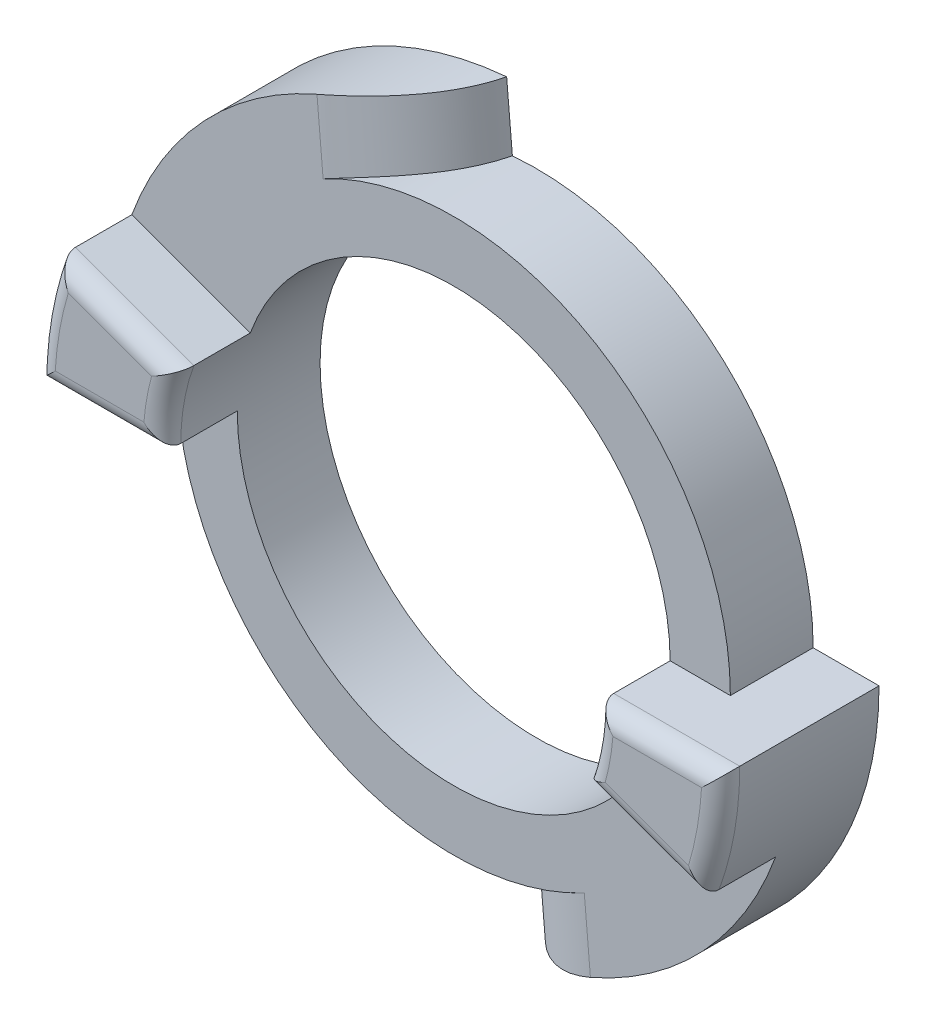
from build123d import *

# Parameters (mm, degrees)
BOSS_EXTRUDE1_DEPTH = 2.2
BOSS_EXTRUDE2_DEPTH = 2
FILLET1_R           = 0.5
FILLET2_R           = 3


with BuildPart() as part:
    # Sketch3 → Boss-Extrude1 (new body)
    with BuildSketch(Plane.XY):
        with BuildLine():
            ThreePointArc((-7.35, 0), (-7.238336985, 1.276314106), (-6.906740763, 2.513848053))
            Line((-6.906740763, 2.513848053), (-8.551202849, 3.112383304))
            ThreePointArc((-8.551202849, 3.112383304), (-8.961750552, 1.580198417), (-9.1, 0))
            Line((-9.1, 0), (-7.35, 0))
        make_face()
        with BuildLine():
            Line((-8.551202849, 3.112383304), (-6.906740763, 2.513848053))
            ThreePointArc((-6.906740763, 2.513848053), (-4.474396503, 5.831147051), (-0.640594709, 7.322031031))
            Line((-0.640594709, 7.322031031), (-0.793117259, 9.065371753))
            ThreePointArc((-0.793117259, 9.065371753), (-5.539729004, 7.219515397), (-8.551202849, 3.112383304))
        make_face()
        with BuildLine():
            Line((3.550704156, 6.15), (7.101408311, 0))
            Line((7.101408311, 0), (7.35, 0))
            ThreePointArc((7.35, 0), (4.965588026, 5.418988426), (-0.640594709, 7.322031031))
            Line((-0.640594709, 7.322031031), (-0.538055281, 6.15))
            Line((-0.538055281, 6.15), (3.550704156, 6.15))
        make_face()
        with BuildLine():
            ThreePointArc((-0.501145521, 5.728119514), (3.884643694, 4.239344687), (5.75, 0))
            Line((5.75, 0), (7.101408311, 0))
            Line((7.101408311, 0), (3.550704156, 6.15))
            Line((3.550704156, 6.15), (-0.538055281, 6.15))
            Line((-0.538055281, 6.15), (-0.501145521, 5.728119514))
        make_face()
        with BuildLine():
            Line((-5.868261699, 2.135872585), (-5.40323257, 1.966615824))
            ThreePointArc((-5.40323257, 1.966615824), (-3.500378217, 4.561781707), (-0.501145521, 5.728119514))
            Line((-0.501145521, 5.728119514), (-0.538055281, 6.15))
            Line((-0.538055281, 6.15), (-3.550704156, 6.15))
            Line((-3.550704156, 6.15), (-5.868261699, 2.135872585))
        make_face()
        with BuildLine():
            Line((-6.906740763, 2.513848053), (-5.868261699, 2.135872585))
            Line((-5.868261699, 2.135872585), (-3.550704156, 6.15))
            Line((-3.550704156, 6.15), (-0.538055281, 6.15))
            Line((-0.538055281, 6.15), (-0.640594709, 7.322031031))
            ThreePointArc((-0.640594709, 7.322031031), (-4.474396503, 5.831147051), (-6.906740763, 2.513848053))
        make_face()
        with BuildLine():
            Line((-7.101408311, 0), (-5.868261699, 2.135872585))
            Line((-5.868261699, 2.135872585), (-6.906740763, 2.513848053))
            ThreePointArc((-6.906740763, 2.513848053), (-7.238336985, 1.276314106), (-7.35, 0))
            Line((-7.35, 0), (-7.101408311, 0))
        make_face()
        with BuildLine():
            ThreePointArc((-5.75, 0), (-5.66264458, 0.998477022), (-5.40323257, 1.966615824))
            Line((-5.40323257, 1.966615824), (-5.868261699, 2.135872585))
            Line((-5.868261699, 2.135872585), (-7.101408311, 0))
            Line((-7.101408311, 0), (-5.75, 0))
        make_face()
        with BuildLine():
            Line((7.101408311, 0), (5.868261699, -2.135872585))
            Line((5.868261699, -2.135872585), (6.906740763, -2.513848053))
            ThreePointArc((6.906740763, -2.513848053), (7.238336985, -1.276314106), (7.35, 0))
            Line((7.35, 0), (7.101408311, 0))
        make_face()
        with BuildLine():
            ThreePointArc((5.75, 0), (5.66264458, -0.998477022), (5.40323257, -1.966615824))
            Line((5.40323257, -1.966615824), (5.868261699, -2.135872585))
            Line((5.868261699, -2.135872585), (7.101408311, 0))
            Line((7.101408311, 0), (5.75, 0))
        make_face()
        with BuildLine():
            Line((6.906740763, -2.513848053), (5.868261699, -2.135872585))
            Line((5.868261699, -2.135872585), (3.550704156, -6.15))
            Line((3.550704156, -6.15), (0.538055281, -6.15))
            Line((0.538055281, -6.15), (0.640594709, -7.322031031))
            ThreePointArc((0.640594709, -7.322031031), (4.474396503, -5.831147051), (6.906740763, -2.513848053))
        make_face()
        with BuildLine():
            Line((5.868261699, -2.135872585), (5.40323257, -1.966615824))
            ThreePointArc((5.40323257, -1.966615824), (3.500378217, -4.561781707), (0.501145521, -5.728119514))
            Line((0.501145521, -5.728119514), (0.538055281, -6.15))
            Line((0.538055281, -6.15), (3.550704156, -6.15))
            Line((3.550704156, -6.15), (5.868261699, -2.135872585))
        make_face()
        with BuildLine():
            Line((-3.550704156, -6.15), (-7.101408311, 0))
            Line((-7.101408311, 0), (-7.35, 0))
            ThreePointArc((-7.35, 0), (-4.965588026, -5.418988426), (0.640594709, -7.322031031))
            Line((0.640594709, -7.322031031), (0.538055281, -6.15))
            Line((0.538055281, -6.15), (-3.550704156, -6.15))
        make_face()
        with BuildLine():
            ThreePointArc((0.501145521, -5.728119514), (-3.884643694, -4.239344687), (-5.75, 0))
            Line((-5.75, 0), (-7.101408311, 0))
            Line((-7.101408311, 0), (-3.550704156, -6.15))
            Line((-3.550704156, -6.15), (0.538055281, -6.15))
            Line((0.538055281, -6.15), (0.501145521, -5.728119514))
        make_face()
        with BuildLine():
            Line((8.551202849, -3.112383304), (6.906740763, -2.513848053))
            ThreePointArc((6.906740763, -2.513848053), (4.474396503, -5.831147051), (0.640594709, -7.322031031))
            Line((0.640594709, -7.322031031), (0.793117259, -9.065371753))
            ThreePointArc((0.793117259, -9.065371753), (5.539729004, -7.219515397), (8.551202849, -3.112383304))
        make_face()
        with BuildLine():
            ThreePointArc((7.35, 0), (7.238336985, -1.276314106), (6.906740763, -2.513848053))
            Line((6.906740763, -2.513848053), (8.551202849, -3.112383304))
            ThreePointArc((8.551202849, -3.112383304), (8.961750552, -1.580198417), (9.1, 0))
            Line((9.1, 0), (7.35, 0))
        make_face()
    extrude(amount=BOSS_EXTRUDE1_DEPTH)

    # Sketch4 → Boss-Extrude2 (add)
    with BuildSketch(Plane.XY.offset(2.2)):
        with BuildLine():
            Line((-7.35, 0), (-5.75, 0))
            ThreePointArc((-5.75, 0), (-5.66264458, 0.998477022), (-5.40323257, 1.966615824))
            Line((-5.40323257, 1.966615824), (-8.551202849, 3.112383304))
            ThreePointArc((-8.551202849, 3.112383304), (-8.961750552, 1.580198417), (-9.1, 0))
            Line((-9.1, 0), (-7.35, 0))
        make_face()
        with BuildLine():
            Line((7.35, 0), (5.75, 0))
            ThreePointArc((5.75, 0), (5.66264458, -0.998477022), (5.40323257, -1.966615824))
            Line((5.40323257, -1.966615824), (8.551202849, -3.112383304))
            ThreePointArc((8.551202849, -3.112383304), (8.961750552, -1.580198417), (9.1, 0))
            Line((9.1, 0), (7.35, 0))
        make_face()
    extrude(amount=BOSS_EXTRUDE2_DEPTH)

    # Fillet1
    fillet1_edges = [part.edges().sort_by_distance(p)[0] for p in [
        (-5.66264458, 0.998477022, 4.2),
        (-6.977217709, 2.539499564, 4.2),
        (-8.961750552, 1.580198417, 4.2),
        (-7.425, 0, 4.2),
        (5.66264458, -0.998477022, 4.2),
        (6.977217709, -2.539499564, 4.2),
        (8.961750552, -1.580198417, 4.2),
        (7.425, 0, 4.2),
    ]]
    fillet(fillet1_edges, radius=FILLET1_R)

    # Fillet2
    # the kernel refuses this fillet: 3 mm, written as the material it takes off along each edge
    with BuildSketch(Plane(origin=(0.010596731, -0.121121189, 2.2), x_dir=(0.9961946980917455, 0.08715574274765829, 0), z_dir=(0.0871557427476583, -0.9961946980917455, 0))) as fillet2_piece_1_section:
        with BuildLine():
            CenterArc((2.891366459, -3), FILLET2_R, 90, 74.533990047)
            Line((0, -2.2), (0, 0))
            Line((0, 0), (2.891366459, 0))
        make_face()
    fillet2_piece_1 = extrude(amount=16.206832295, mode=Mode.PRIVATE)
    fillet2_piece_1 = fillet2_piece_1 - Plane(origin=(0, 0, 1.592242212), x_dir=(1, 0, 0), z_dir=(0, 0, -1)) * Cylinder(7.35, 44, mode=Mode.PRIVATE)
    add(fillet2_piece_1, mode=Mode.SUBTRACT)
    with BuildSketch(Plane(origin=(-0.010596731, 0.121121189, 2.2), x_dir=(-0.9961946980917455, -0.08715574274765826, 0), z_dir=(-0.08715574274765826, 0.9961946980917455, 0))) as fillet2_piece_2_section:
        with BuildLine():
            CenterArc((2.891366459, -3), FILLET2_R, 90, 74.533990047)
            Line((0, -2.2), (0, 0))
            Line((0, 0), (2.891366459, 0))
        make_face()
    fillet2_piece_2 = extrude(amount=16.206832295, mode=Mode.PRIVATE)
    fillet2_piece_2 = fillet2_piece_2 - Plane(origin=(0, 0, 1.592242212), x_dir=(1, 0, 0), z_dir=(0, 0, -1)) * Cylinder(7.35, 44, mode=Mode.PRIVATE)
    add(fillet2_piece_2, mode=Mode.SUBTRACT)


solid = part.part
